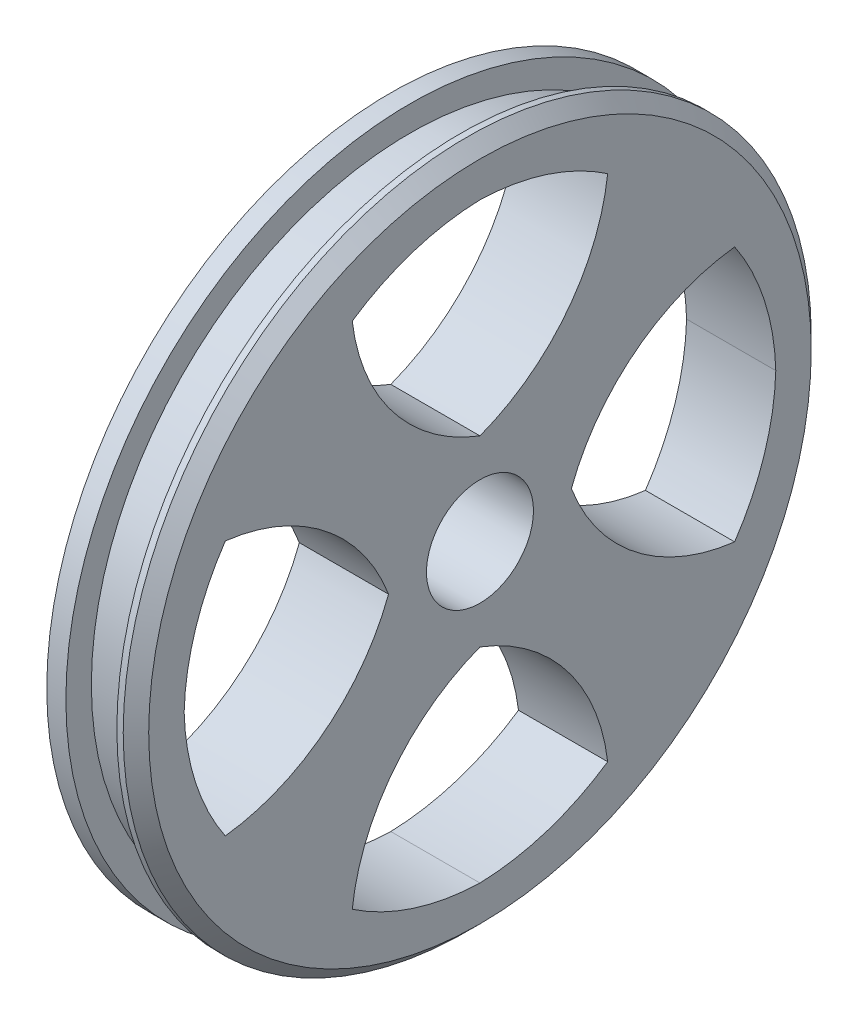
from build123d import *

# Parameters (mm, degrees)
SKETCH1_R           = 13.5
SKETCH1_R_2         = 2.1
BOSS_EXTRUDE1_DEPTH = 1.75
CUT_EXTRUDE1_DEPTH  = 20.17191957
CIRPATTERN1_COUNT   = 4
CHAMFER1_SIZE       = 0.5
SKETCH4_R           = 13.5
SKETCH4_R_2         = 12.5
CUT_EXTRUDE3_DEPTH  = 1


with BuildPart() as part:
    # Sketch1 → Boss-Extrude1 (new, symmetric)
    with BuildSketch(Plane(origin=(0, 0, 0), x_dir=(0, 0, -1), z_dir=(1, 0, 0))):
        Circle(SKETCH1_R)
        Circle(SKETCH1_R_2, mode=Mode.SUBTRACT)
    extrude(amount=BOSS_EXTRUDE1_DEPTH, both=True)

    # Sketch2 → Cut-Extrude1 (cut, symmetric)
    with BuildSketch(Plane(origin=(0, 0, 0), x_dir=(0, 0, -1), z_dir=(1, 0, 0))):
        with BuildLine():
            ThreePointArc((0, 3.587478321), (-3.402339743, 6.089548883), (-5.012219469, 9.99397715))
            ThreePointArc((-5.012219469, 9.99397715), (-2.621563936, 11.159720287), (0, 11.6087119))
            ThreePointArc((0, 11.6087119), (2.621563936, 11.159720287), (5.012219469, 9.99397715))
            ThreePointArc((5.012219469, 9.99397715), (3.402339743, 6.089548883), (0, 3.587478321))
        make_face()
    cut_extrude1 = extrude(amount=CUT_EXTRUDE1_DEPTH, both=True, mode=Mode.SUBTRACT)

    # CirPattern1: Cut-Extrude1 ×4 about axis
    cirpattern1_axis = Axis((1.75, 0, 0), (-1, 0, 0))
    for i in range(1, CIRPATTERN1_COUNT):
        add(cut_extrude1.rotate(cirpattern1_axis, i * 360 / CIRPATTERN1_COUNT), mode=Mode.SUBTRACT)

    # Chamfer1
    chamfer1_edges = [part.edges().sort_by_distance(p)[0] for p in [
        (1.75, 0, 13.5),
    ]]
    chamfer(chamfer1_edges, length=CHAMFER1_SIZE)

    # Sketch4 → Cut-Extrude3 (cut, symmetric)
    with BuildSketch(Plane(origin=(0, 0, 0), x_dir=(0, 0, -1), z_dir=(1, 0, 0))):
        Circle(SKETCH4_R)
        Circle(SKETCH4_R_2, mode=Mode.SUBTRACT)
    extrude(amount=CUT_EXTRUDE3_DEPTH, both=True, mode=Mode.SUBTRACT)


solid = part.part
